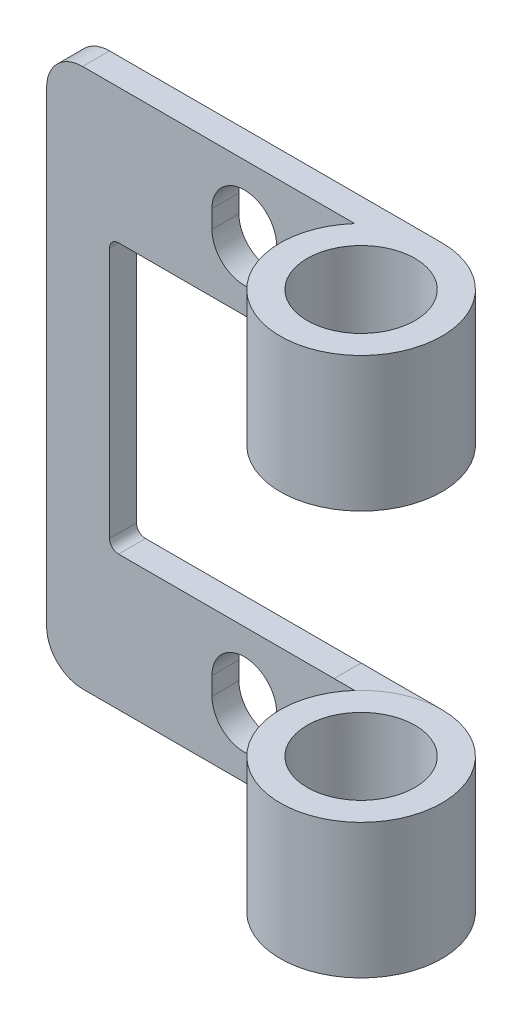
from build123d import *

# Parameters (mm, degrees)
SKETCH_2_W             = 16
SKETCH_2_H             = 30
SM_BASE_FLANGE_1_DEPTH = 1.5
SKETCH_7_R             = 4.5
SKETCH_7_R_2           = 3
EXTRUDE_1_DEPTH        = 30
SKETCH_8_W             = 1.5
SKETCH_8_H             = 7.5
EXTRUDE_1_2_DEPTH      = 4.5
SKETCH_9_W             = 25
SKETCH_9_H             = 15
CUT_EXTRUDE_1_DEPTH    = 41.074929819
FILLET_1_R             = 2
CUT_EXTRUDE_2_DEPTH    = 10
FILLET_2_R             = 0.5


# Sheet-metal steps are written as plain solids
with BuildPart() as part:
    # Sketch 2 → Базовая кромка1 (new body)
    with BuildSketch(Plane.XY):
        with Locations((8, -15)):
            Rectangle(SKETCH_2_W, SKETCH_2_H)
    extrude(amount=-SM_BASE_FLANGE_1_DEPTH)



with BuildPart() as body_2:
    # Эскиз7 → Extrude 1 (new body)
    with BuildSketch(Plane.XZ.offset(30)):
        with Locations((20.5, 3)):
            Circle(SKETCH_7_R)
        with Locations((20.5, 3)):
            Circle(SKETCH_7_R_2, mode=Mode.SUBTRACT)
    extrude(amount=-EXTRUDE_1_DEPTH)


with BuildPart() as part_1:
    add(part.part)

    add(body_2.part)  # Extrude 1 2 merges body 2
    # Эскиз8 → Extrude 1 2 (add)
    with BuildSketch(Plane(origin=(16, 0, 0), x_dir=(0, 0, -1), z_dir=(1, 0, 0))):
        with Locations((0.75, -26.25)):
            Rectangle(SKETCH_8_W, SKETCH_8_H)
        with Locations((0.75, -3.75)):
            Rectangle(SKETCH_8_W, SKETCH_8_H)
    extrude(amount=EXTRUDE_1_2_DEPTH)

    # Эскиз9 → Вырез-Вытянуть1 (cut, through all)
    with BuildSketch(Plane.XY.offset(-1.5)):
        with Locations((16, -15)):
            Rectangle(SKETCH_9_W, SKETCH_9_H)
    extrude(amount=CUT_EXTRUDE_1_DEPTH, mode=Mode.SUBTRACT)

    # Скругление1
    fillet_1_edges = [part_1.edges().sort_by_distance(p)[0] for p in [
        (0, 0, -0.75),
        (0, -30, -0.75),
    ]]
    fillet(fillet_1_edges, radius=FILLET_1_R)

    # Эскиз10 → Вырез-Вытянуть2 (cut)
    with BuildSketch(Plane.XY):
        with BuildLine():
            Line((9.2, -26.75), (9.2, -25.75))
            ThreePointArc((9.2, -25.75), (11, -23.95), (12.8, -25.75))
            Line((12.8, -25.75), (12.8, -26.75))
            ThreePointArc((12.8, -26.75), (11, -28.55), (9.2, -26.75))
        make_face()
        with BuildLine():
            Line((9.2, -3.25), (9.2, -4.25))
            ThreePointArc((9.2, -4.25), (11, -6.05), (12.8, -4.25))
            Line((12.8, -4.25), (12.8, -3.25))
            ThreePointArc((12.8, -3.25), (11, -1.45), (9.2, -3.25))
        make_face()
    extrude(amount=-CUT_EXTRUDE_2_DEPTH, mode=Mode.SUBTRACT)

    # Скругление2
    fillet_2_edges = [part_1.edges().sort_by_distance(p)[0] for p in [
        (3.5, -22.5, -0.75),
        (3.5, -7.5, -0.75),
    ]]
    fillet(fillet_2_edges, radius=FILLET_2_R)


solid = part_1.part
